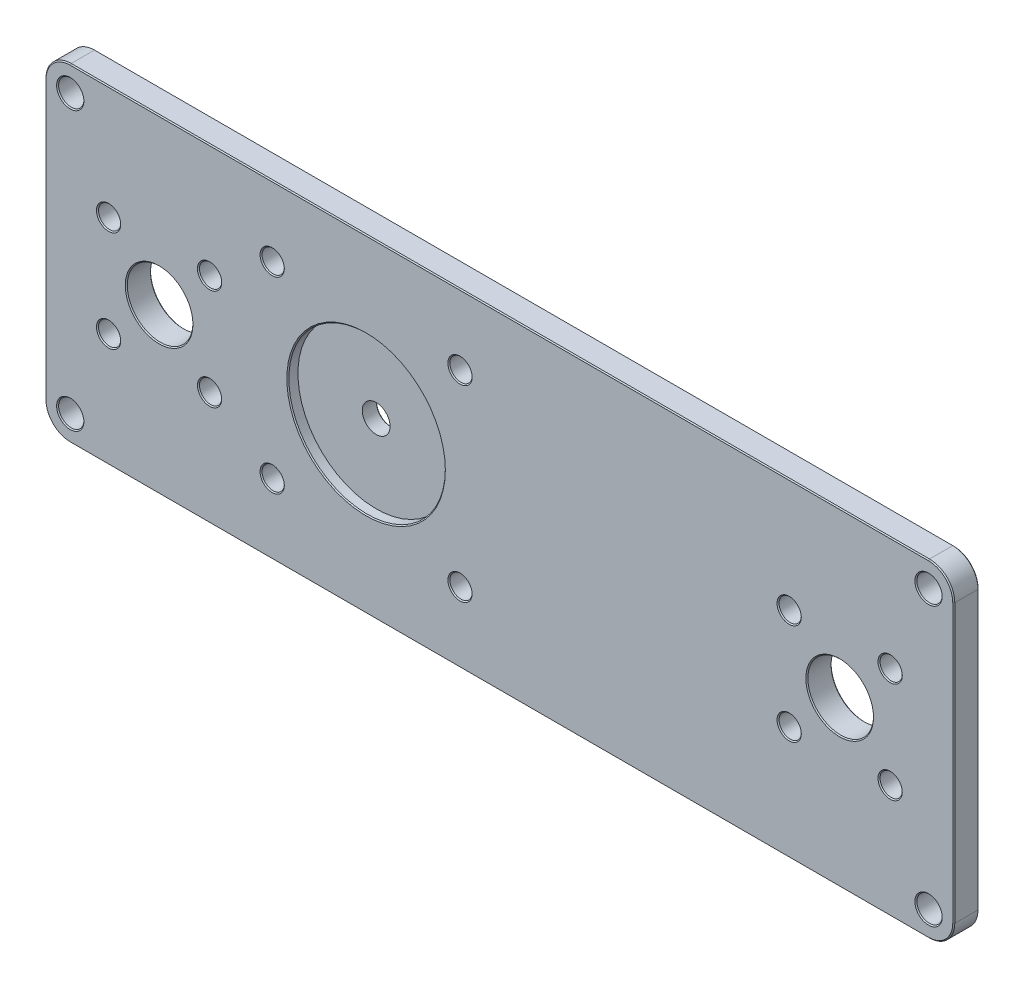
from build123d import *

# Parameters (mm, degrees)
SKETCH3_R           = 3.175
SKETCH3_R_2         = 2.794
SKETCH3_R_3         = 8.255
SKETCH3_R_4         = 19.685
BOSS_EXTRUDE1_DEPTH = 6.35
SKETCH3_4_R         = 19.685
SKETCH3_4_R_2       = 3.4925
BOSS_EXTRUDE2_DEPTH = 3.81
CHAMFER1_SIZE       = 0.254


with BuildPart() as part:
    # Sketch3 → Boss-Extrude1 (new body)
    with BuildSketch(Plane.XY):
        with BuildLine():
            Line((-107.95, -41.275), (107.95, -41.275))
            ThreePointArc((107.95, -41.275), (112.440128061, -39.415128061), (114.3, -34.925))
            Line((114.3, -34.925), (114.3, 34.925))
            ThreePointArc((114.3, 34.925), (112.440128061, 39.415128061), (107.95, 41.275))
            Line((107.95, 41.275), (-107.95, 41.275))
            ThreePointArc((-107.95, 41.275), (-112.440128061, 39.415128061), (-114.3, 34.925))
            Line((-114.3, 34.925), (-114.3, -34.925))
            ThreePointArc((-114.3, -34.925), (-112.440128061, -39.415128061), (-107.95, -41.275))
        make_face()
        with Locations((-107.95, -34.925)):
            Circle(SKETCH3_R, mode=Mode.SUBTRACT)
        with Locations((-57.15, -23.622)):
            Circle(SKETCH3_R_2, mode=Mode.SUBTRACT)
        with Locations((-9.906, -23.622)):
            Circle(SKETCH3_R_2, mode=Mode.SUBTRACT)
        with Locations((-98.298, -12.7)):
            Circle(SKETCH3_R_2, mode=Mode.SUBTRACT)
        with Locations((-72.898, -12.7)):
            Circle(SKETCH3_R_2, mode=Mode.SUBTRACT)
        with Locations((-85.598, 0)):
            Circle(SKETCH3_R_3, mode=Mode.SUBTRACT)
        with Locations((107.95, -34.925)):
            Circle(SKETCH3_R, mode=Mode.SUBTRACT)
        with Locations((72.898, -12.7)):
            Circle(SKETCH3_R_2, mode=Mode.SUBTRACT)
        with Locations((98.298, -12.7)):
            Circle(SKETCH3_R_2, mode=Mode.SUBTRACT)
        with Locations((-98.298, 12.7)):
            Circle(SKETCH3_R_2, mode=Mode.SUBTRACT)
        with Locations((-72.898, 12.7)):
            Circle(SKETCH3_R_2, mode=Mode.SUBTRACT)
        with Locations((-33.528, 0)):
            Circle(SKETCH3_R_4, mode=Mode.SUBTRACT)
        with Locations((-107.95, 34.925)):
            Circle(SKETCH3_R, mode=Mode.SUBTRACT)
        with Locations((-57.15, 23.622)):
            Circle(SKETCH3_R_2, mode=Mode.SUBTRACT)
        with Locations((-9.906, 23.622)):
            Circle(SKETCH3_R_2, mode=Mode.SUBTRACT)
        with Locations((85.598, 0)):
            Circle(SKETCH3_R_3, mode=Mode.SUBTRACT)
        with Locations((72.898, 12.7)):
            Circle(SKETCH3_R_2, mode=Mode.SUBTRACT)
        with Locations((98.298, 12.7)):
            Circle(SKETCH3_R_2, mode=Mode.SUBTRACT)
        with Locations((107.95, 34.925)):
            Circle(SKETCH3_R, mode=Mode.SUBTRACT)
    extrude(amount=BOSS_EXTRUDE1_DEPTH)

    # Sketch3<4> → Boss-Extrude2 (add)
    with BuildSketch(Plane.XY):
        with Locations((-33.528, 0)):
            Circle(SKETCH3_4_R)
        with Locations((-33.528, 0)):
            Circle(SKETCH3_4_R_2, mode=Mode.SUBTRACT)
    extrude(amount=BOSS_EXTRUDE2_DEPTH)

    # Chamfer1
    chamfer1_edges = [part.edges().sort_by_distance(p)[0] for p in [
        (-37.0205, 0, 0),
        (-112.440128061, 39.415128061, 0),
        (-114.3, 0, 0),
        (-112.440128061, -39.415128061, 0),
        (0, -41.275, 0),
        (112.440128061, -39.415128061, 0),
        (114.3, 0, 0),
        (112.440128061, 39.415128061, 0),
        (0, 41.275, 0),
        (-59.944, 23.622, 0),
        (-12.7, 23.622, 0),
        (-12.7, -23.622, 0),
        (-59.944, -23.622, 0),
        (-111.125, 34.925, 0),
        (-111.125, -34.925, 0),
        (104.775, -34.925, 0),
        (104.775, 34.925, 0),
        (112.440128061, 39.415128061, 6.35),
        (114.3, 0, 6.35),
        (112.440128061, -39.415128061, 6.35),
        (0, -41.275, 6.35),
        (-112.440128061, -39.415128061, 6.35),
        (-114.3, 0, 6.35),
        (-112.440128061, 39.415128061, 6.35),
        (0, 41.275, 6.35),
        (-59.944, 23.622, 6.35),
        (-12.7, 23.622, 6.35),
        (-12.7, -23.622, 6.35),
        (-59.944, -23.622, 6.35),
        (-111.125, 34.925, 6.35),
        (-111.125, -34.925, 6.35),
        (104.775, -34.925, 6.35),
        (104.775, 34.925, 6.35),
        (-53.213, 0, 6.35),
        (77.343, 0, 0),
        (70.104, 12.7, 0),
        (95.504, 12.7, 0),
        (95.504, -12.7, 0),
        (70.104, -12.7, 0),
        (77.343, 0, 6.35),
        (70.104, 12.7, 6.35),
        (95.504, 12.7, 6.35),
        (95.504, -12.7, 6.35),
        (70.104, -12.7, 6.35),
        (-93.853, 0, 0),
        (-75.692, -12.7, 0),
        (-75.692, 12.7, 0),
        (-101.092, 12.7, 0),
        (-101.092, -12.7, 0),
        (-93.853, 0, 6.35),
        (-75.692, -12.7, 6.35),
        (-75.692, 12.7, 6.35),
        (-101.092, 12.7, 6.35),
        (-101.092, -12.7, 6.35),
    ]]
    chamfer(chamfer1_edges, length=CHAMFER1_SIZE)


solid = part.part
